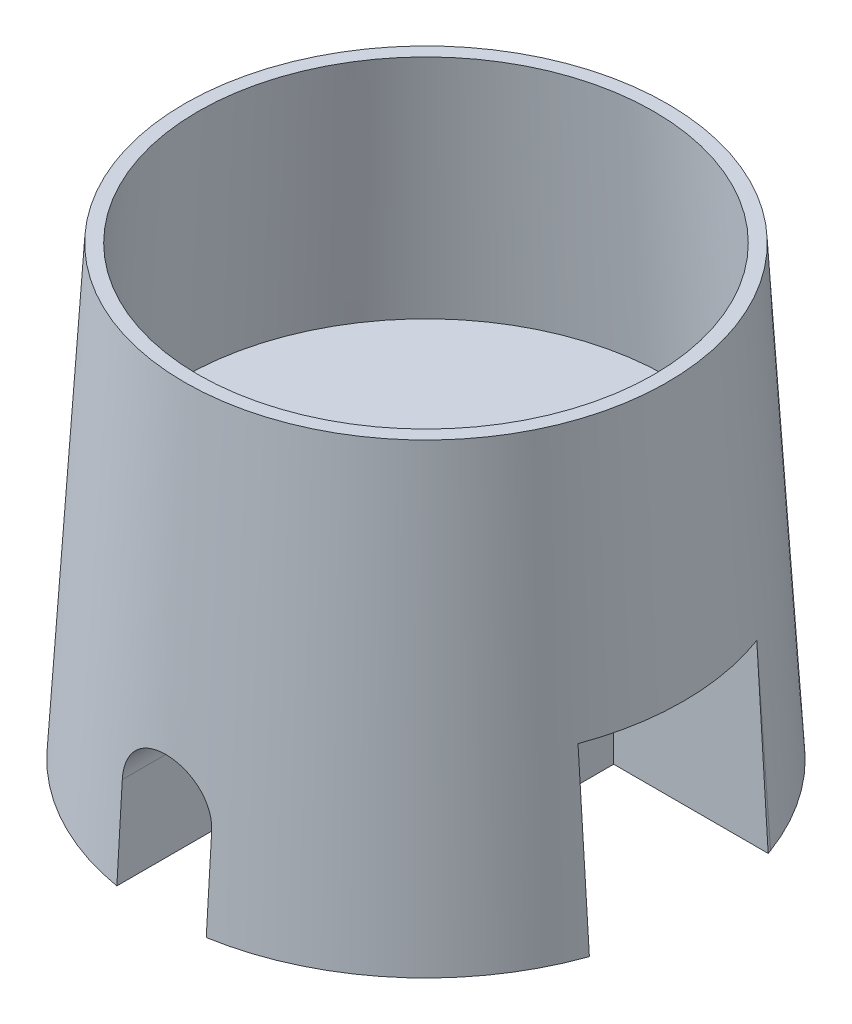
from build123d import *

# Parameters (mm, degrees)
SKETCH_5_W            = 40
SKETCH_5_H            = 60
CUT_EXTRUDE_1_DEPTH   = 40
CUT_EXTRUDE_START     = -22
SKETCH_6_W            = 40
SKETCH_6_H            = 40
CUT_EXTRUDE_2_DEPTH   = 40
CUT_EXTRUDE_START_2   = 22
SKETCH_9_W            = 40
SKETCH_9_H            = 40
CUT_EXTRUDE_3_DEPTH   = 40
CUT_EXTRUDE_4_DEPTH   = 40
F_2_5MM_1_D           = 2.5
F_2_5MM_1_CSINK_D     = 2.55
F_2_5MM_1_CSINK_ANGLE = 90


with BuildPart() as part:
    # 草图3 → 旋转2 (revolve)
    with BuildSketch(Plane(origin=(0, 0, 0), x_dir=(0, 0, -1), z_dir=(1, 0, 0))):
        Polygon((0, 0), (60, 0), (54, 100), (0, 100), align=None)
    revolve(axis=Axis((0, 100, 0), (0, -1, 0)))

    # 草图5 → 切除-拉伸1 (cut)
    with BuildSketch(Plane(origin=(0, 0, 0), x_dir=(-1, 0, 0), z_dir=(0, -1, 0))):
        Rectangle(SKETCH_5_W, SKETCH_5_H)
    extrude(amount=-CUT_EXTRUDE_1_DEPTH, mode=Mode.SUBTRACT)

    # 草图6 → 切除-拉伸2 (cut)
    with BuildSketch(Plane(origin=(0, 0, 0), x_dir=(0, 0, -1), z_dir=(1, 0, 0)).offset(CUT_EXTRUDE_START)):
        with Locations((0, 20)):
            Rectangle(SKETCH_6_W, SKETCH_6_H)
    extrude(amount=-CUT_EXTRUDE_2_DEPTH, mode=Mode.SUBTRACT)

    # 草图9 → 切除-拉伸3 (cut)
    with BuildSketch(Plane(origin=(0, 0, 0), x_dir=(0, 0, -1), z_dir=(1, 0, 0)).offset(CUT_EXTRUDE_START_2)):
        with Locations((0, 20)):
            Rectangle(SKETCH_9_W, SKETCH_9_H)
    extrude(amount=CUT_EXTRUDE_3_DEPTH, mode=Mode.SUBTRACT)

    # 草图10 → 切除-拉伸4 (cut)
    with BuildSketch(Plane(origin=(0, 0, 30), x_dir=(-1, 0, 0), z_dir=(0, 0, -1))):
        with BuildLine():
            Line((-10, 0), (-10, 20))
            ThreePointArc((-10, 20), (0, 30), (10, 20))
            Line((10, 20), (10, 0))
            Line((10, 0), (-10, 0))
        make_face()
    extrude(amount=-CUT_EXTRUDE_4_DEPTH, mode=Mode.SUBTRACT)

    # 草图11 → 切除-旋转1 (revolve, cut)
    with BuildSketch(Plane.XY):
        Polygon((-50.994604851, 100), (-54.174604851, 47), (0, 47), (0, 100), align=None)
    revolve(axis=Axis((0, 47, 0), (0, 1, 0)), mode=Mode.SUBTRACT)

    # Ø2.5mm 暗销孔1 (through all)
    with Locations(Plane(origin=(0, 47, 0), x_dir=(1, 0, 0), z_dir=(0, 1, 0))):
        with Locations((41.5, -13.5), (-10.5, 13.5), (-10.5, -13.5), (41.5, 13.5)):
            CounterSinkHole(F_2_5MM_1_D / 2, F_2_5MM_1_CSINK_D / 2, counter_sink_angle=F_2_5MM_1_CSINK_ANGLE)


solid = part.part
